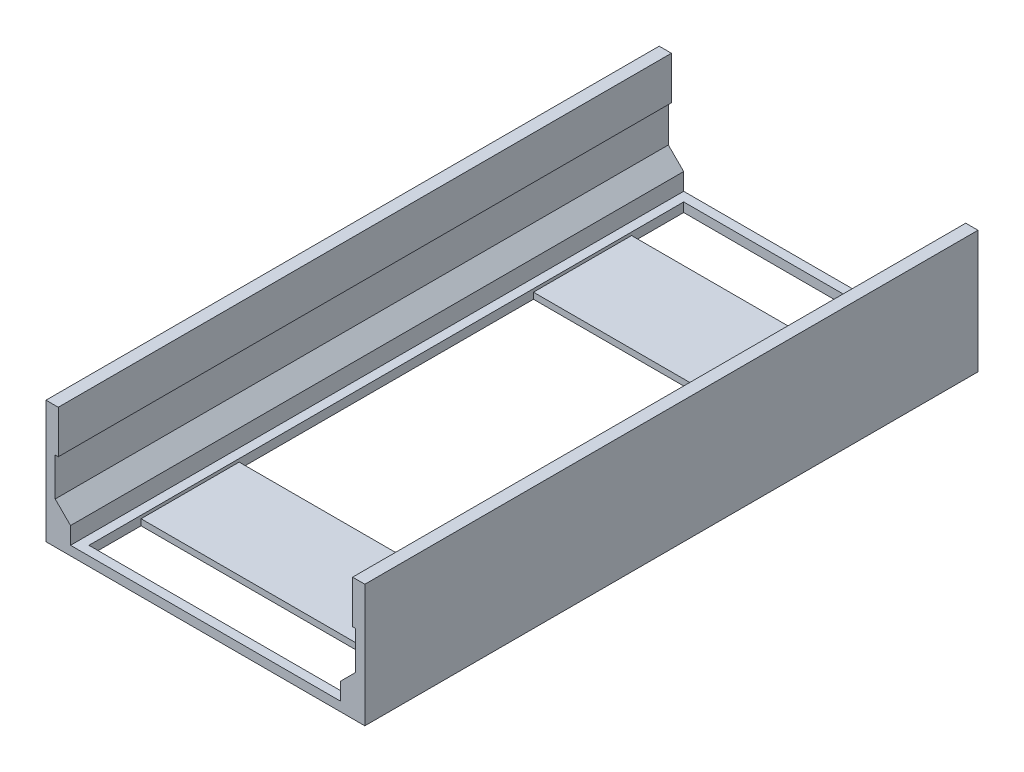
from build123d import *

# Parameters (mm, degrees)
RESSALTO_EXTRUS_O1_DEPTH = 100
RESSALTO_EXTRUS_O3_REACH = 107.835
ESBO_O3_W                = 45
ESBO_O3_H                = 1.5
CORTE_EXTRUS_O1_DEPTH    = 103.343783397
ESBO_O5_W                = 12
ESBO_O5_H                = 1.5
CORTE_EXTRUS_O2_DEPTH    = 106.834776893
ESBO_O6_W                = 45
ESBO_O6_H                = 2
RESSALTO_EXTRUS_O4_DEPTH = 25
ESBO_O7_W                = 2.8
ESBO_O7_H                = 2.8
CORTE_EXTRUS_O3_DEPTH    = 10
CORTE_EXTRUS_O4_DEPTH    = 104.788245963
RESSALTO_EXTRUS_O5_DEPTH = 100
ESBO_O10_W               = 0.5
ESBO_O10_H               = 8
CORTE_EXTRUS_O5_DEPTH    = 104.788245963
CHANFRO1_SIZE            = 3
CHANFRO2_SIZE            = 3
RESSALTO_EXTRUS_O6_DEPTH = 100
CORTE_EXTRUS_O6_DEPTH    = 105.556204981
ESBO_O13_W               = 41
ESBO_O13_H               = 97.00005
CORTE_EXTRUS_O7_DEPTH    = 105.967852222
ESBO_O14_W               = 41
ESBO_O14_H               = 16
RESSALTO_EXTRUS_O7_DEPTH = 1


with BuildPart() as part:
    # Esboço1 → Ressalto-extrusão1 (new body)
    with BuildSketch(Plane.XY):
        Polygon((-22.5, 12.5), (-22.5, -7.5), (-17.5, -12.5), (17.5, -12.5), (22.5, -7.5), (22.5, 12.5), (24, 12.5), (24, -9), (19, -14), (-19, -14), (-24, -9), (-24, 12.5), align=None)
    extrude(amount=RESSALTO_EXTRUS_O1_DEPTH)

    # Ressalto-extrusão3: up to this face of the body (flat: up to its plane)
    ressalto_extrus_o3_end = Plane(part.part.faces().sort_by_distance((-23.25, 12.5, 50))[0])
    # Esboço3 → Ressalto-extrusão3 (add, up to the picked face)
    with BuildSketch(Plane(origin=(0, -12.5, 0), x_dir=(1, 0, 0), z_dir=(0, 1, 0)), mode=Mode.PRIVATE) as ressalto_extrus_o3_sk1:
        with Locations((0, -0.75)):
            Rectangle(ESBO_O3_W, ESBO_O3_H)
    ressalto_extrus_o3_tool1 = split(extrude(ressalto_extrus_o3_sk1.sketch, amount=RESSALTO_EXTRUS_O3_REACH, mode=Mode.PRIVATE), bisect_by=ressalto_extrus_o3_end, keep=Keep.BOTH, mode=Mode.PRIVATE)
    add(ressalto_extrus_o3_tool1.solids().sort_by(Axis((0, -12.5, 0.75), (0, 1, 0)))[0])

    # Esboço4 → Corte-extrusão1 (cut, through all)
    with BuildSketch(Plane.XY.offset(1.5)):
        Polygon((-10, -12.5), (10, -12.5), (10, -7.5), (5, -2.5), (-5, -2.5), (-10, -7.5), align=None)
    extrude(amount=-CORTE_EXTRUS_O1_DEPTH, mode=Mode.SUBTRACT)

    # Esboço5 → Corte-extrusão2 (cut, through all)
    with BuildSketch(Plane(origin=(0, -12.5, 0), x_dir=(1, 0, 0), z_dir=(0, 1, 0))):
        with Locations((0, -2.25)):
            Rectangle(ESBO_O5_W, ESBO_O5_H)
    extrude(amount=-CORTE_EXTRUS_O2_DEPTH, mode=Mode.SUBTRACT)

    # Esboço6 → Ressalto-extrusão4 (add)
    with BuildSketch(Plane(origin=(0, -12.5, 0), x_dir=(1, 0, 0), z_dir=(0, 1, 0))):
        with Locations((0, -99)):
            Rectangle(ESBO_O6_W, ESBO_O6_H)
    extrude(amount=RESSALTO_EXTRUS_O4_DEPTH)

    # Esboço7 → Corte-extrusão3 (cut)
    with BuildSketch(Plane.XY.offset(100)):
        with Locations((-8, 8.5)):
            Rectangle(ESBO_O7_W, ESBO_O7_H)
        with Locations((-16, 8.5)):
            Rectangle(ESBO_O7_W, ESBO_O7_H)
        with Locations((0, 8.5)):
            Rectangle(ESBO_O7_W, ESBO_O7_H)
        with Locations((8, 8.5)):
            Rectangle(ESBO_O7_W, ESBO_O7_H)
        with Locations((16, 8.5)):
            Rectangle(ESBO_O7_W, ESBO_O7_H)
        with Locations((-8, 0.5)):
            Rectangle(ESBO_O7_W, ESBO_O7_H)
        with Locations((0, 0.5)):
            Rectangle(ESBO_O7_W, ESBO_O7_H)
        with Locations((8, 0.5)):
            Rectangle(ESBO_O7_W, ESBO_O7_H)
        with Locations((16, 0.5)):
            Rectangle(ESBO_O7_W, ESBO_O7_H)
        with Locations((-8, -7.5)):
            Rectangle(ESBO_O7_W, ESBO_O7_H)
        with Locations((0, -7.5)):
            Rectangle(ESBO_O7_W, ESBO_O7_H)
        with Locations((8, -7.5)):
            Rectangle(ESBO_O7_W, ESBO_O7_H)
        with Locations((16, -7.5)):
            Rectangle(ESBO_O7_W, ESBO_O7_H)
        with Locations((-16, 0.5)):
            Rectangle(ESBO_O7_W, ESBO_O7_H)
        with Locations((-16, -7.5)):
            Rectangle(ESBO_O7_W, ESBO_O7_H)
    extrude(amount=-CORTE_EXTRUS_O3_DEPTH, mode=Mode.SUBTRACT)

    # Esboço8 → Corte-extrusão4 (cut, through all)
    with BuildSketch(Plane(origin=(0, 0, 0), x_dir=(-1, 0, 0), z_dir=(0, 0, -1))):
        Polygon((-22.5, -10.5), (-22.5, -12.5), (-20.5, -12.5), align=None)
        Polygon((20.5, -12.5), (22.5, -12.5), (22.5, -10.5), align=None)
    extrude(amount=-CORTE_EXTRUS_O4_DEPTH, mode=Mode.SUBTRACT)

    # Esboço9 → Ressalto-extrusão5 (add, through all)
    with BuildSketch(Plane(origin=(0, 0, 0), x_dir=(-1, 0, 0), z_dir=(0, 0, -1))):
        Polygon((-19, -14), (-21.5, -14), (-21.5, -11.5), align=None)
        Polygon((19, -14), (21.5, -14), (21.5, -11.5), align=None)
    extrude(amount=-RESSALTO_EXTRUS_O5_DEPTH)

    # Esboço10 → Corte-extrusão5 (cut, through all)
    with BuildSketch(Plane(origin=(0, 0, 0), x_dir=(-1, 0, 0), z_dir=(0, 0, -1))):
        with Locations((-23.75, 0.5)):
            Rectangle(ESBO_O10_W, ESBO_O10_H)
        with Locations((23.75, 0.5)):
            Rectangle(ESBO_O10_W, ESBO_O10_H)
    extrude(amount=-CORTE_EXTRUS_O5_DEPTH, mode=Mode.SUBTRACT)

    # Chanfro1
    # the kernel refuses this chamfer: 3 mm, written as the material it adds along each edge
    with BuildSketch(Plane(origin=(22.5, -15.215048964, 98), x_dir=(0.027495876610586768, 0, -0.9996219169112968), z_dir=(0, 1, 0))) as chanfro1_piece_1_section:
        Polygon((CHANFRO1_SIZE * 0.999621916911, CHANFRO1_SIZE * 0.0274958766106), (-CHANFRO1_SIZE * 0.0274958766106, CHANFRO1_SIZE * 0.999621916911), (0, 0), align=None)
    chanfro1_piece_1 = extrude(amount=27.715048964, mode=Mode.PRIVATE)
    chanfro1_piece_1 = split(chanfro1_piece_1, bisect_by=Plane(origin=(27.146986971, -2.853013029, 96.73534202), z_dir=(-0.7071067811865475, 0.7071067811865476, 0)), keep=Keep.TOP, mode=Mode.PRIVATE)
    add(chanfro1_piece_1)
    with BuildSketch(Plane(origin=(12.04463656, -17.95536344, 98), x_dir=(-0.7068394360706735, 0.7068394360706735, 0.027495876610586778), z_dir=(0.7071067811865476, 0.7071067811865475, 0))) as chanfro1_piece_2_section:
        Polygon((CHANFRO1_SIZE * 0.999621916911, -CHANFRO1_SIZE * 0.0274958766106), (-CHANFRO1_SIZE * 0.0274958766106, -CHANFRO1_SIZE * 0.999621916911), (0, 0), align=None)
    chanfro1_piece_2 = extrude(amount=22.50116574, mode=Mode.PRIVATE)
    chanfro1_piece_2 = split(chanfro1_piece_2, bisect_by=Plane(origin=(16.362312496, -12.5, 97.266244129), z_dir=(0, 1, 0)), keep=Keep.TOP, mode=Mode.PRIVATE)
    chanfro1_piece_2 = split(chanfro1_piece_2, bisect_by=Plane(origin=(16.362312496, -8.9, 97.266244129), z_dir=(0, -1, 0)), keep=Keep.TOP, mode=Mode.PRIVATE)
    add(chanfro1_piece_2)
    with BuildSketch(Plane(origin=(12.04463656, -17.95536344, 98), x_dir=(-0.7068394360706735, 0.7068394360706735, 0.027495876610586778), z_dir=(0.7071067811865476, 0.7071067811865475, 0))) as chanfro1_piece_3_section:
        Polygon((CHANFRO1_SIZE * 0.999621916911, -CHANFRO1_SIZE * 0.0274958766106), (-CHANFRO1_SIZE * 0.0274958766106, -CHANFRO1_SIZE * 0.999621916911), (0, 0), align=None)
    chanfro1_piece_3 = extrude(amount=22.50116574, mode=Mode.PRIVATE)
    chanfro1_piece_3 = split(chanfro1_piece_3, bisect_by=Plane(origin=(22.5, -7.314063038, 97.124733651), z_dir=(-1, 0, 0)), keep=Keep.TOP, mode=Mode.PRIVATE)
    chanfro1_piece_3 = split(chanfro1_piece_3, bisect_by=Plane(origin=(17.4, -7.314063038, 97.124733651), z_dir=(1, 0, 0)), keep=Keep.TOP, mode=Mode.PRIVATE)
    add(chanfro1_piece_3)
    with BuildSketch(Plane(origin=(25.215048964, -12.5, 98), x_dir=(0, -0.02749587661058619, -0.9996219169112968), z_dir=(-1, 0, 0))) as chanfro1_piece_4_section:
        Polygon((CHANFRO1_SIZE * 0.999621916911, -CHANFRO1_SIZE * 0.0274958766106), (-CHANFRO1_SIZE * 0.0274958766106, -CHANFRO1_SIZE * 0.999621916911), (0, 0), align=None)
    chanfro1_piece_4 = extrude(amount=50.430097928, mode=Mode.PRIVATE)
    chanfro1_piece_4 = split(chanfro1_piece_4, bisect_by=Plane(origin=(-9.263513514, -20.736486486, 97.013513514), z_dir=(0.7071067811865475, 0.7071067811865476, 0)), keep=Keep.TOP, mode=Mode.PRIVATE)
    chanfro1_piece_4 = split(chanfro1_piece_4, bisect_by=Plane(origin=(9.263513514, -20.736486486, 97.013513514), z_dir=(-0.7071067811865475, 0.7071067811865476, 0)), keep=Keep.TOP, mode=Mode.PRIVATE)
    add(chanfro1_piece_4)
    with BuildSketch(Plane(origin=(-27.95536344, -2.04463656, 98), x_dir=(0.7068394360706733, 0.7068394360706736, 0.027495876610586757), z_dir=(0.7071067811865476, -0.7071067811865475, 0))) as chanfro1_piece_5_section:
        Polygon((CHANFRO1_SIZE * 0.999621916911, -CHANFRO1_SIZE * 0.0274958766106), (-CHANFRO1_SIZE * 0.0274958766106, -CHANFRO1_SIZE * 0.999621916911), (0, 0), align=None)
    chanfro1_piece_5 = extrude(amount=22.50116574, mode=Mode.PRIVATE)
    chanfro1_piece_5 = split(chanfro1_piece_5, bisect_by=Plane(origin=(-22.5, -3.439339828, 97.957106781), z_dir=(1, 0, 0)), keep=Keep.TOP, mode=Mode.PRIVATE)
    chanfro1_piece_5 = split(chanfro1_piece_5, bisect_by=Plane(origin=(-17.4, -3.439339828, 97.957106781), z_dir=(-1, 0, 0)), keep=Keep.TOP, mode=Mode.PRIVATE)
    add(chanfro1_piece_5)
    with BuildSketch(Plane(origin=(-27.95536344, -2.04463656, 98), x_dir=(0.7068394360706733, 0.7068394360706736, 0.027495876610586757), z_dir=(0.7071067811865476, -0.7071067811865475, 0))) as chanfro1_piece_6_section:
        Polygon((CHANFRO1_SIZE * 0.999621916911, -CHANFRO1_SIZE * 0.0274958766106), (-CHANFRO1_SIZE * 0.0274958766106, -CHANFRO1_SIZE * 0.999621916911), (0, 0), align=None)
    chanfro1_piece_6 = extrude(amount=22.50116574, mode=Mode.PRIVATE)
    chanfro1_piece_6 = split(chanfro1_piece_6, bisect_by=Plane(origin=(-16.362312496, -12.5, 97.266244129), z_dir=(0, 1, 0)), keep=Keep.TOP, mode=Mode.PRIVATE)
    chanfro1_piece_6 = split(chanfro1_piece_6, bisect_by=Plane(origin=(-16.362312496, -8.9, 97.266244129), z_dir=(0, -1, 0)), keep=Keep.TOP, mode=Mode.PRIVATE)
    add(chanfro1_piece_6)
    with BuildSketch(Plane(origin=(-22.5, -15.215048964, 98), x_dir=(-0.027495876610586768, 0, -0.9996219169112968), z_dir=(0, 1, 0))) as chanfro1_piece_7_section:
        Polygon((CHANFRO1_SIZE * 0.999621916911, -CHANFRO1_SIZE * 0.0274958766106), (-CHANFRO1_SIZE * 0.0274958766106, -CHANFRO1_SIZE * 0.999621916911), (0, 0), align=None)
    chanfro1_piece_7 = extrude(amount=27.715048964, mode=Mode.PRIVATE)
    chanfro1_piece_7 = split(chanfro1_piece_7, bisect_by=Plane(origin=(-27.146986971, -2.853013029, 96.73534202), z_dir=(0.7071067811865475, 0.7071067811865476, 0)), keep=Keep.TOP, mode=Mode.PRIVATE)
    add(chanfro1_piece_7)

    # Chanfro2
    chanfro2_edges = [part.edges().sort_by_distance(p)[0] for p in [
        (-13.75, -12.5, 1.5),
        (20, -10, 1.5),
        (-22.5, 2.5, 1.5),
        (-20, -10, 1.5),
        (22.5, 2.5, 1.5),
        (13.75, -12.5, 1.5),
    ]]
    chamfer(chanfro2_edges, length=CHANFRO2_SIZE)

    # Esboço12 → Corte-extrusão6 (cut, through all)
    with BuildSketch(Plane(origin=(0, 0, 0), x_dir=(-1, 0, 0), z_dir=(0, 0, -1))):
        Polygon((24, -9), (24, -3.5), (23.5, -3.5), (23.5, 4.5), (24, 4.5), (24, 12.5), (-24, 12.5), (-24, 4.5), (-23.5, 4.5), (-23.5, -3.5), (-24, -3.5), (-24, -9), (-21.5, -11.5), (-21.5, -14), (21.5, -14), (21.5, -11.5), align=None)
    extrude(amount=-CORTE_EXTRUS_O6_DEPTH, mode=Mode.SUBTRACT)


with BuildPart() as body_2:
    # Esboço11 → Ressalto-extrusão6 (new, through all)
    with BuildSketch(Plane(origin=(0, 0, 0), x_dir=(-1, 0, 0), z_dir=(0, 0, -1))):
        Polygon((24.5, -9.207106781), (24.5, -3), (24, -3), (24, 4), (26, 4), (26, -14.5), (26, -16), (-26, -16), (-26, -14.5), (-26, 4), (-24, 4), (-24, -3), (-24.5, -3), (-24.5, -9.207106781), (-22, -11.707106781), (-22, -14.5), (22, -14.5), (22, -11.707106781), align=None)
    extrude(amount=-RESSALTO_EXTRUS_O6_DEPTH)

    # Esboço13 → Corte-extrusão7 (cut, through all)
    with BuildSketch(Plane(origin=(0, -14.5, 0), x_dir=(1, 0, 0), z_dir=(0, 1, 0))):
        with Locations((0, -50.000025)):
            Rectangle(ESBO_O13_W, ESBO_O13_H)
    extrude(amount=-CORTE_EXTRUS_O7_DEPTH, mode=Mode.SUBTRACT)

    # Esboço14 → Ressalto-extrusão7 (add)
    with BuildSketch(Plane.XZ.offset(16)):
        with Locations((0, 82.00005)):
            Rectangle(ESBO_O14_W, ESBO_O14_H)
        with Locations((0, 18)):
            Rectangle(ESBO_O14_W, ESBO_O14_H)
    extrude(amount=-RESSALTO_EXTRUS_O7_DEPTH)


solid = body_2.part
